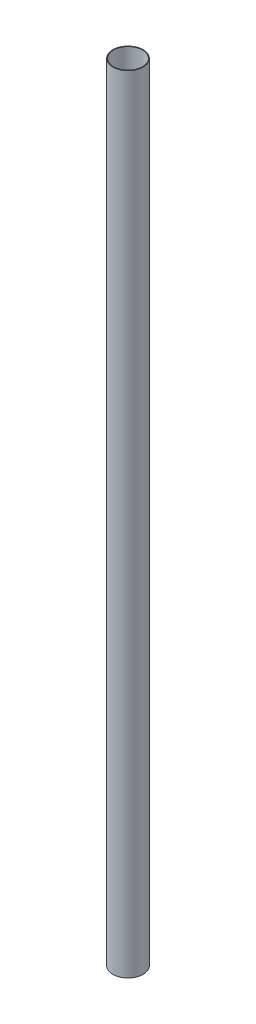
from build123d import *

# Parameters (mm, degrees)
SZKIC1_R                    = 23.1
SZKIC1_R_2                  = 22.1
DODANIE_WYCI_GNI_CIE1_DEPTH = 1200


with BuildPart() as part:
    # Szkic1 → Dodanie-wyciągnięcie1 (new body)
    with BuildSketch(Plane(origin=(0, 0, 0), x_dir=(1, 0, 0), z_dir=(0, 1, 0))):
        Circle(SZKIC1_R)
        Circle(SZKIC1_R_2, mode=Mode.SUBTRACT)
    extrude(amount=DODANIE_WYCI_GNI_CIE1_DEPTH)


solid = part.part
